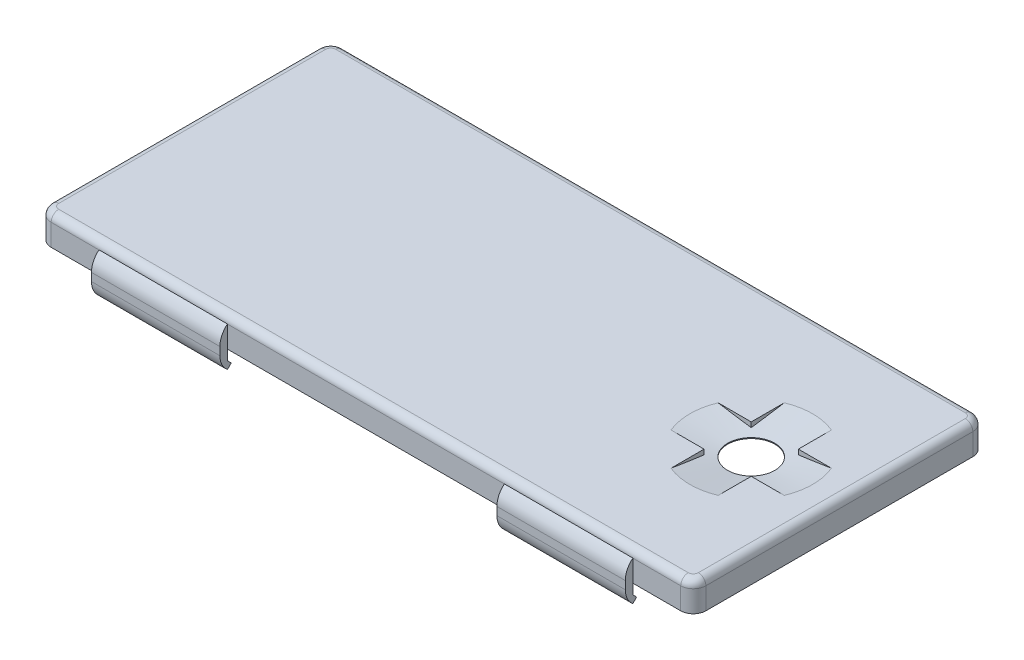
from build123d import *

# Parameters (mm, degrees)
SKETCH1_W              = 260
SKETCH1_H              = 116
BOSS_EXTRUDE1_DEPTH    = 11.62
FILLET1_R              = 5
FILLET2_R              = 3
SKETCH2_W              = 254
SKETCH2_H              = 110
CUT_EXTRUDE1_DEPTH     = 8.62
FILLET3_R              = 3
SKETCH6_R              = 9.3599
CUT_EXTRUDE4_DEPTH     = 8.636
SKETCH7_W              = 51
SKETCH7_H              = 15.649055797
BOSS_EXTRUDE3_DEPTH    = 3
FILLET6_R              = 8
FILLET7_R              = 8
SKETCH8_W              = 51
SKETCH8_H              = 3
BOSS_EXTRUDE4_DEPTH    = 1.5
CUT_EXTRUDE5_DEPTH     = 55
LPATTERN2_COUNT        = 2
LPATTERN2_PITCH        = 161
FILLET6_OF_LPATTERN2_R = 8
FILLET7_OF_LPATTERN2_R = 8
SKETCH10_W             = 51
SKETCH10_H             = 15.62
BOSS_EXTRUDE5_DEPTH    = 3
FILLET8_R              = 8
SKETCH11_W             = 51
SKETCH11_H             = 3
BOSS_EXTRUDE6_DEPTH    = 1.5
CUT_EXTRUDE6_DEPTH     = 55
LPATTERN3_COUNT        = 2
LPATTERN3_PITCH        = 161
FILLET8_OF_LPATTERN3_R = 8
CHAMFER1_SIZE          = 15
CHAMFER1_SIZE2         = 2.644904711
SKETCH13_W             = 18.833961405
SKETCH13_H             = 27.155748893
SKETCH13_W_2           = 23.540134481
SKETCH13_H_2           = 26.001362064
SKETCH13_W_3           = 13.410899097
SKETCH13_H_3           = 18.756893662
SKETCH13_W_4           = 15.344585033
SKETCH13_H_4           = 16.316593901
BOSS_EXTRUDE7_DEPTH    = 3


with BuildPart() as part:
    # Sketch1 → Boss-Extrude1 (new body)
    with BuildSketch(Plane(origin=(0, 0, 0), x_dir=(1, 0, 0), z_dir=(0, 1, 0))):
        with Locations((130, 58)):
            Rectangle(SKETCH1_W, SKETCH1_H)
    extrude(amount=BOSS_EXTRUDE1_DEPTH)

    # Fillet1
    fillet1_edges = [part.edges().sort_by_distance(p)[0] for p in [
        (0, 5.81, -116),
        (260, 5.81, -116),
        (260, 5.81, 0),
        (0, 5.81, 0),
    ]]
    fillet(fillet1_edges, radius=FILLET1_R)

    # Fillet2
    fillet2_edges = [part.edges().sort_by_distance(p)[0] for p in [
        (130, 11.62, 0),
        (0, 11.62, -58),
        (260, 11.62, -58),
        (130, 11.62, -116),
        (1.464466094, 11.62, -114.535533906),
        (258.535533906, 11.62, -114.535533906),
        (258.535533906, 11.62, -1.464466094),
        (1.464466094, 11.62, -1.464466094),
    ]]
    fillet(fillet2_edges, radius=FILLET2_R)

    # Sketch2 → Cut-Extrude1 (cut)
    with BuildSketch(Plane.XZ):
        with Locations((130, -58)):
            Rectangle(SKETCH2_W, SKETCH2_H)
    extrude(amount=-CUT_EXTRUDE1_DEPTH, mode=Mode.SUBTRACT)

    # Fillet3
    fillet3_edges = [part.edges().sort_by_distance(p)[0] for p in [
        (3, 4.31, -113),
        (3, 4.31, -3),
        (257, 4.31, -3),
        (257, 4.31, -113),
    ]]
    fillet(fillet3_edges, radius=FILLET3_R)

    # Sketch6 → Cut-Extrude4 (cut)
    with BuildSketch(Plane(origin=(0, 11.62, 0), x_dir=(1, 0, 0), z_dir=(0, 1, 0))):
        with Locations(Location((225, 58, 0), (0, 0, 270))):
            Circle(SKETCH6_R)
    extrude(amount=-CUT_EXTRUDE4_DEPTH, mode=Mode.SUBTRACT)

    # Sketch7 → Boss-Extrude3 (add)
    with BuildSketch(Plane.XY):
        with Locations((49.5, 0.824527899)):
            Rectangle(SKETCH7_W, SKETCH7_H)
    boss_extrude3 = extrude(amount=BOSS_EXTRUDE3_DEPTH)

    # Fillet6
    # the kernel refuses this fillet: 8 mm, written as the material it takes off along each edge
    with BuildSketch(Plane(origin=(8.387505004, 8.649055797, 3), x_dir=(0, 0, -1), z_dir=(1, 0, 0))) as fillet6_piece_1:
        with BuildLine():
            CenterArc((8, -6.244997998), FILLET6_R, 128.682187453, 51.317812547)
            Line((0, -6.244997998), (-0.16, -6.244997998))
            Line((-0.16, -6.244997998), (-0.16, 0))
            Line((-0.16, 0), (0, 0.16))
            ThreePointArc((0, 0.16), (1.5, 0.16), (2.9, 0.12489996))
            Line((2.9, 0.12489996), (3, 0))
        make_face()
    extrude(amount=82.224989992, mode=Mode.SUBTRACT)

    # Fillet7
    # the kernel refuses this fillet: 8 mm, written as the material it takes off along each edge
    with BuildSketch(Plane(origin=(90.612494996, -7, 3), x_dir=(0, 0, -1), z_dir=(-1, 0, 0))) as fillet7_piece_1:
        with BuildLine():
            CenterArc((8, -6.244997998), FILLET7_R, 128.682187453, 51.317812547)
            Line((0, -6.244997998), (-0.16, -6.244997998))
            Line((-0.16, -6.244997998), (-0.16, 0))
            Line((-0.16, 0), (0, 0.16))
            ThreePointArc((0, 0.16), (1.5, 0.16), (2.9, 0.12489996))
            Line((2.9, 0.12489996), (3, 0))
        make_face()
    extrude(amount=82.224989992, mode=Mode.SUBTRACT)

    # Sketch8 → Boss-Extrude4 (add)
    with BuildSketch(Plane(origin=(0, 0, 0), x_dir=(-1, 0, 0), z_dir=(0, 0, -1))):
        with Locations((-49.5, -5.5)):
            Rectangle(SKETCH8_W, SKETCH8_H)
    boss_extrude4 = extrude(amount=BOSS_EXTRUDE4_DEPTH)

    # Sketch9 → Cut-Extrude5 (cut)
    with BuildSketch(Plane.ZY.offset(-24)):
        Polygon((0, -4), (-1.5, -5.5), (0, -7), (-1.5, -7), (-2.053402402, -7), (-2.053402402, -4), (-1.5, -4), align=None)
    cut_extrude5 = extrude(amount=-CUT_EXTRUDE5_DEPTH, mode=Mode.SUBTRACT)

    # LPattern2: Boss-Extrude3, Boss-Extrude4, Cut-Extrude5 ×2
    with Locations(*[(i * LPATTERN2_PITCH, 0, 0) for i in range(1, LPATTERN2_COUNT)]):
        add(boss_extrude3)
        add(boss_extrude4)
        add(cut_extrude5, mode=Mode.SUBTRACT)

    # Fillet6 of LPattern2
    # the kernel refuses this fillet: 8 mm, written as the material it takes off along each edge
    with BuildSketch(Plane(origin=(169.387505004, 8.649055797, 3), x_dir=(0, 0, -1), z_dir=(1, 0, 0))) as fillet6_of_lpattern2_piece_1:
        with BuildLine():
            CenterArc((8, -6.244997998), FILLET6_OF_LPATTERN2_R, 128.682187453, 51.317812547)
            Line((0, -6.244997998), (-0.16, -6.244997998))
            Line((-0.16, -6.244997998), (-0.16, 0))
            Line((-0.16, 0), (0, 0.16))
            ThreePointArc((0, 0.16), (1.5, 0.16), (2.9, 0.12489996))
            Line((2.9, 0.12489996), (3, 0))
        make_face()
    extrude(amount=82.224989992, mode=Mode.SUBTRACT)

    # Fillet7 of LPattern2
    # the kernel refuses this fillet: 8 mm, written as the material it takes off along each edge
    with BuildSketch(Plane(origin=(251.612494996, -7, 3), x_dir=(0, 1, 0), z_dir=(-1, 0, 0))) as fillet7_of_lpattern2_piece_1:
        with BuildLine():
            CenterArc((6.244997998, 8), FILLET7_OF_LPATTERN2_R, 218.682187453, 51.317812547)
            Line((0, 3), (-0.12489996, 2.9))
            ThreePointArc((-0.12489996, 2.9), (-0.16, 1.5), (-0.16, 0))
            Line((-0.16, 0), (0, -0.16))
            Line((0, -0.16), (6.244997998, -0.16))
            Line((6.244997998, -0.16), (6.244997998, 0))
        make_face()
    extrude(amount=82.224989992, mode=Mode.SUBTRACT)

    # Sketch10 → Boss-Extrude5 (add)
    with BuildSketch(Plane(origin=(0, 0, -116), x_dir=(-1, 0, 0), z_dir=(0, 0, -1))):
        with Locations((-49.5, 0.81)):
            Rectangle(SKETCH10_W, SKETCH10_H)
    boss_extrude5 = extrude(amount=BOSS_EXTRUDE5_DEPTH)

    # Fillet8
    # the kernel refuses this fillet: 8 mm, written as the material it takes off along each edge
    with BuildSketch(Plane(origin=(8.387505004, -7, -119), x_dir=(0, 0, 1), z_dir=(1, 0, 0)), Plane(origin=(90.612494996, 8.62, -119), x_dir=(0, 0, 1), z_dir=(-1, 0, 0))) as fillet8_piece_1:
        with BuildLine():
            CenterArc((8, -6.244997998), FILLET8_R, 128.682187453, 51.317812547)
            Line((0, -6.244997998), (-0.16, -6.244997998))
            Line((-0.16, -6.244997998), (-0.16, 0))
            Line((-0.16, 0), (0, 0.16))
            ThreePointArc((0, 0.16), (1.5, 0.16), (2.9, 0.12489996))
            Line((2.9, 0.12489996), (3, 0))
        make_face()
    extrude(amount=82.224989992, mode=Mode.SUBTRACT)

    # Sketch11 → Boss-Extrude6 (add)
    with BuildSketch(Plane.XY.offset(-116)):
        with Locations((49.5, -5.5)):
            Rectangle(SKETCH11_W, SKETCH11_H)
    boss_extrude6 = extrude(amount=BOSS_EXTRUDE6_DEPTH)

    # Sketch12 → Cut-Extrude6 (cut)
    with BuildSketch(Plane.ZY.offset(-24)):
        Polygon((-116, -4), (-114.5, -5.5), (-116, -7), (-111.986018157, -7), (-111.986018157, -3.7983216), align=None)
    cut_extrude6 = extrude(amount=-CUT_EXTRUDE6_DEPTH, mode=Mode.SUBTRACT)

    # LPattern3: Boss-Extrude5, Boss-Extrude6, Cut-Extrude6 ×2
    with Locations(*[(i * LPATTERN3_PITCH, 0, 0) for i in range(1, LPATTERN3_COUNT)]):
        add(boss_extrude5)
        add(boss_extrude6)
        add(cut_extrude6, mode=Mode.SUBTRACT)

    # Fillet8 of LPattern3
    # the kernel refuses this fillet: 8 mm, written as the material it takes off along each edge
    with BuildSketch(Plane(origin=(169.387505004, -7, -119), x_dir=(0, 0, 1), z_dir=(1, 0, 0)), Plane(origin=(251.612494996, 8.62, -119), x_dir=(0, 0, 1), z_dir=(-1, 0, 0))) as fillet8_of_lpattern3_piece_1:
        with BuildLine():
            CenterArc((8, -6.244997998), FILLET8_OF_LPATTERN3_R, 128.682187453, 51.317812547)
            Line((0, -6.244997998), (-0.16, -6.244997998))
            Line((-0.16, -6.244997998), (-0.16, 0))
            Line((-0.16, 0), (0, 0.16))
            ThreePointArc((0, 0.16), (1.5, 0.16), (2.9, 0.12489996))
            Line((2.9, 0.12489996), (3, 0))
        make_face()
    extrude(amount=82.224989992, mode=Mode.SUBTRACT)

    # Chamfer1
    chamfer1_edges = [part.edges().sort_by_distance(p)[0] for p in [
        (225, 11.62, -67.3599),
    ]]
    chamfer1_side = [part.faces().sort_by_distance(p)[0] for p in [
        (129.054758669, 11.62, -58),
    ]]
    chamfer(chamfer1_edges, length=CHAMFER1_SIZE, length2=CHAMFER1_SIZE2, reference=chamfer1_side[0])

    # Sketch13 → Boss-Extrude7 (add)
    with BuildSketch(Plane(origin=(0, 11.62, 0), x_dir=(1, 0, 0), z_dir=(0, 1, 0))):
        with Locations((243.776980702, 80.937874447)):
            Rectangle(SKETCH13_W, SKETCH13_H)
        with Locations((203.86993276, 80.360681032)):
            Rectangle(SKETCH13_W_2, SKETCH13_H_2)
        with Locations((241.065449548, 39.261553169)):
            Rectangle(SKETCH13_W_3, SKETCH13_H_3)
        with Locations((207.967707484, 40.481703049)):
            Rectangle(SKETCH13_W_4, SKETCH13_H_4)
    extrude(amount=-BOSS_EXTRUDE7_DEPTH)


solid = part.part
